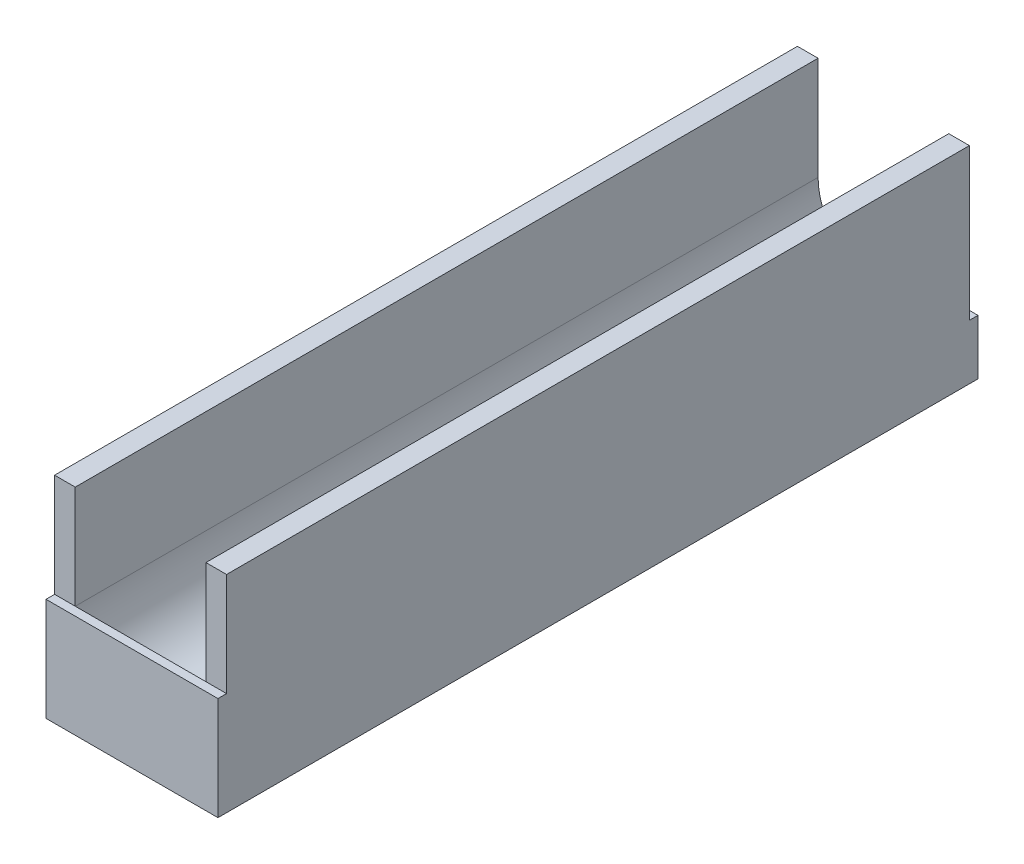
from build123d import *

# Parameters (mm, degrees)
SKETCH1_W                   = 31.75
SKETCH1_H                   = 38.1
BOSS_EXTRUDE1_DEPTH         = 137.16
CUT_EXTRUDE1_DEPTH          = 144.235788911
SKETCH3_R                   = 2
HEAT_SET_INSERT_HOLES_DEPTH = 7
SKETCH4_W                   = 31.75
SKETCH4_H                   = 19.05
BOSS_EXTRUDE2_DEPTH         = 1.5875
SKETCH5_W                   = 31.75
SKETCH5_H                   = 10.16
BOSS_EXTRUDE3_DEPTH         = 1.5875


with BuildPart() as part:
    # Sketch1 → Boss-Extrude1 (new body)
    with BuildSketch(Plane.XY):
        with Locations((0, 19.05)):
            Rectangle(SKETCH1_W, SKETCH1_H)
    extrude(amount=BOSS_EXTRUDE1_DEPTH)

    # Sketch2 → Cut-Extrude1 (cut, through all)
    with BuildSketch(Plane.XY.offset(137.16)):
        with BuildLine():
            Line((-12.065, 19.05), (-12.065, 38.1))
            Line((-12.065, 38.1), (12.065, 38.1))
            Line((12.065, 38.1), (12.065, 19.05))
            ThreePointArc((12.065, 19.05), (0, 6.985), (-12.065, 19.05))
        make_face()
    extrude(amount=-CUT_EXTRUDE1_DEPTH, mode=Mode.SUBTRACT)

    # Sketch3 → heat set insert holes (cut)
    with BuildSketch(Plane.XZ):
        with Locations((-12.7, 129.54)):
            Circle(SKETCH3_R)
        with Locations((12.7, 7.62)):
            Circle(SKETCH3_R)
    extrude(amount=-HEAT_SET_INSERT_HOLES_DEPTH, mode=Mode.SUBTRACT)

    # Sketch4 → Boss-Extrude2 (add)
    with BuildSketch(Plane.XY.offset(137.16)):
        with Locations((0, 9.525)):
            Rectangle(SKETCH4_W, SKETCH4_H)
    extrude(amount=BOSS_EXTRUDE2_DEPTH)

    # Sketch5 → Boss-Extrude3 (add)
    with BuildSketch(Plane(origin=(0, 0, 0), x_dir=(-1, 0, 0), z_dir=(0, 0, -1))):
        with Locations((0, 5.08)):
            Rectangle(SKETCH5_W, SKETCH5_H)
    extrude(amount=BOSS_EXTRUDE3_DEPTH)


solid = part.part
